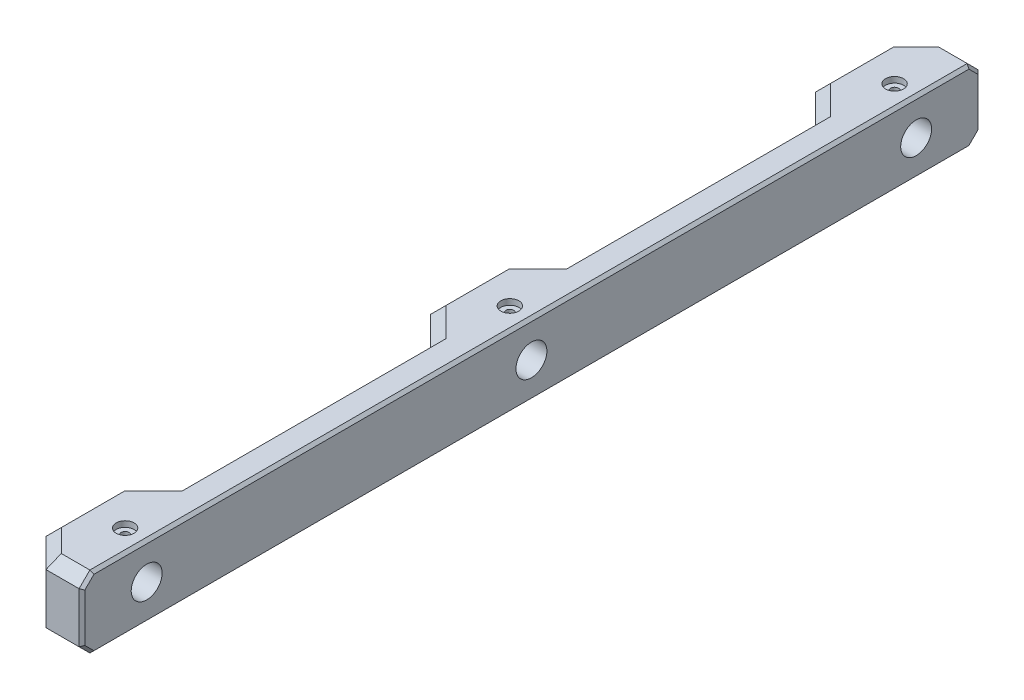
from build123d import *

# Parameters (mm, degrees)
BOSS_EXTRUDE1_DEPTH                          = 20
SKETCH2_R                                    = 4.3
CUT_EXTRUDE1_DEPTH                           = 13
CBORE_START                                  = 18.4
CBORE_FOR_M2_PAN_HEAD_MACHINE_SCREW1_OUT_R   = 2.5
CBORE_FOR_M2_PAN_HEAD_MACHINE_SCREW1_DEPTH   = 1.6
CBORE_START_2                                = 14.156921837
CBORE_FOR_M2_PAN_HEAD_MACHINE_SCREW1_2_O_R   = 1.1
CBORE_FOR_M2_PAN_HEAD_MACHINE_SCREW1_2_DEPTH = 4.243078163
CHAMFER1_SIZE                                = 3
CHAMFER2_SIZE                                = 0.8
SKETCH2_5_R                                  = 4.3
CUT_EXTRUDE5_DEPTH                           = 252.443830706


# Read off the part's stored shape, not the designer's step: CBORE for M2 Pan Head Machine Screw1
with BuildPart() as part:
    # Sketch1 → Boss-Extrude1 (new body)
    with BuildSketch(Plane(origin=(0, 0, 0), x_dir=(1, 0, 0), z_dir=(0, 1, 0))):
        Polygon((-10, 214), (-10, 143), (-18, 135), (-18, 115), (-10, 107), (-10, 36), (-18, 28), (-18, 8), (-10, 0), (0, 0), (0, 250), (-10, 250), (-18, 242), (-18, 222), align=None)
    extrude(amount=BOSS_EXTRUDE1_DEPTH)

    # Sketch2 → Cut-Extrude1 (cut)
    with BuildSketch(Plane(origin=(0, 0, 0), x_dir=(0, 0, -1), z_dir=(1, 0, 0))):
        with Locations((18, 10)):
            Circle(SKETCH2_R)
        with Locations((125, 10)):
            Circle(SKETCH2_R)
        with Locations((232, 10)):
            Circle(SKETCH2_R)
    extrude(amount=-CUT_EXTRUDE1_DEPTH, mode=Mode.SUBTRACT)

    # CBORE for M2 Pan Head Machine Screw1 out → CBORE for M2 Pan Head Machine Screw1 (cut)
    with BuildSketch(Plane(origin=(0, 0, 0), x_dir=(1, 0, 0), z_dir=(0, 1, 0)).offset(CBORE_START)):
        with Locations((-6, 18)):
            Circle(CBORE_FOR_M2_PAN_HEAD_MACHINE_SCREW1_OUT_R)
        with Locations((-6, 232)):
            Circle(CBORE_FOR_M2_PAN_HEAD_MACHINE_SCREW1_OUT_R)
        with Locations((-6, 125)):
            Circle(CBORE_FOR_M2_PAN_HEAD_MACHINE_SCREW1_OUT_R)
    extrude(amount=CBORE_FOR_M2_PAN_HEAD_MACHINE_SCREW1_DEPTH, mode=Mode.SUBTRACT)

    # CBORE for M2 Pan Head Machine Screw1 2 o → CBORE for M2 Pan Head Machine Screw1 2 (cut)
    with BuildSketch(Plane(origin=(0, 0, 0), x_dir=(1, 0, 0), z_dir=(0, 1, 0)).offset(CBORE_START_2)):
        with Locations((-6, 18)):
            Circle(CBORE_FOR_M2_PAN_HEAD_MACHINE_SCREW1_2_O_R)
        with Locations((-6, 232)):
            Circle(CBORE_FOR_M2_PAN_HEAD_MACHINE_SCREW1_2_O_R)
        with Locations((-6, 125)):
            Circle(CBORE_FOR_M2_PAN_HEAD_MACHINE_SCREW1_2_O_R)
    extrude(amount=CBORE_FOR_M2_PAN_HEAD_MACHINE_SCREW1_2_DEPTH, mode=Mode.SUBTRACT)

    # Chamfer1
    chamfer1_edges = [part.edges().sort_by_distance(p)[0] for p in [
        (-14, 20, -246),
        (-5, 0, 0),
        (-14, 0, -4),
        (-18, 0, -18),
        (-14, 0, -32),
        (-10, 0, -71.5),
        (-14, 0, -111),
        (-18, 0, -125),
        (-14, 0, -139),
        (-18, 20, -232),
        (-10, 0, -178.5),
        (-14, 0, -218),
        (-18, 0, -232),
        (-14, 0, -246),
        (-5, 0, -250),
        (-14, 20, -218),
        (-10, 20, -178.5),
        (-14, 20, -139),
        (-18, 20, -125),
        (-14, 20, -111),
        (-10, 20, -71.5),
        (-14, 20, -32),
        (-18, 20, -18),
        (-14, 20, -4),
        (-5, 20, 0),
        (-5, 20, -250),
    ]]
    chamfer(chamfer1_edges, length=CHAMFER1_SIZE)

    # Chamfer2
    chamfer2_edges = [part.edges().sort_by_distance(p)[0] for p in [
        (0, 10, 0),
        (0, 0, -125),
        (0, 10, -250),
        (0, 20, -125),
        (0, 18.5, -1.5),
        (0, 18.5, -248.5),
        (0, 1.5, -248.5),
        (0, 1.5, -1.5),
    ]]
    chamfer(chamfer2_edges, length=CHAMFER2_SIZE)

    # Sketch2<5> → Cut-Extrude5 (cut, through all)
    with BuildSketch(Plane(origin=(0, 0, 0), x_dir=(0, 0, -1), z_dir=(1, 0, 0))):
        with Locations((232, 10)):
            Circle(SKETCH2_5_R)
    extrude(amount=-CUT_EXTRUDE5_DEPTH, mode=Mode.SUBTRACT)


solid = part.part
